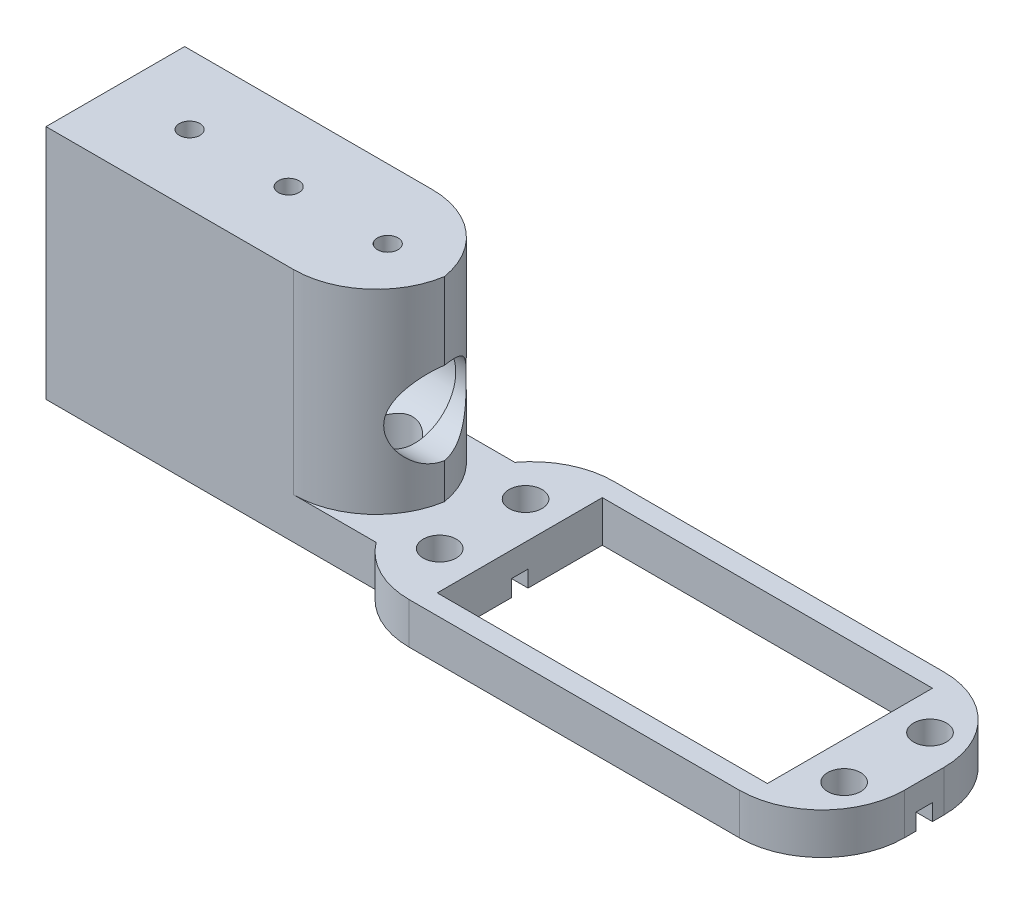
from build123d import *

# Parameters (mm, degrees)
SKETCH1_R           = 2
BOSS_EXTRUDE1_DEPTH = 5
SKETCH2_W           = 2
SKETCH2_H           = 4
CUT_EXTRUDE1_DEPTH  = 63.375956906
BOSS_EXTRUDE2_DEPTH = 28.625
FILLET1_R           = 10
CUT_EXTRUDE2_DEPTH  = 36.25
CUT_EXTRUDE3_REACH  = 73.653
SKETCH5_R           = 5
FILLET4_R           = 10
SKETCH8_R           = 3
CUT_EXTRUDE6_DEPTH  = 22
SKETCH9_R           = 1.25
CUT_EXTRUDE7_DEPTH  = 59.195876265
FILLET5_R           = 2


with BuildPart() as part:
    # Sketch1 → Boss-Extrude1 (new body)
    with BuildSketch(Plane(origin=(0, 0, 0), x_dir=(1, 0, 0), z_dir=(0, 1, 0))):
        Polygon((-9, 2.4), (-9, 0), (-9, -22.4), (49, -22.4), (49, 2.4), align=None)
        with Locations(Location((-4.5, -15.2, 0), (0, 0, 270))):
            Circle(SKETCH1_R, mode=Mode.SUBTRACT)
        with Locations(Location((44.5, -15.2, 0), (0, 0, 270))):
            Circle(SKETCH1_R, mode=Mode.SUBTRACT)
        with Locations(Location((-4.5, -4.8, 0), (0, 0, 270))):
            Circle(SKETCH1_R, mode=Mode.SUBTRACT)
        Polygon((0, -4.8), (0, 0), (20, 0), (40, 0), (40, -10), (40, -20), (20, -20), (0, -20), (0, -10), align=None, mode=Mode.SUBTRACT)
        with Locations(Location((44.5, -4.8, 0), (0, 0, 270))):
            Circle(SKETCH1_R, mode=Mode.SUBTRACT)
    extrude(amount=BOSS_EXTRUDE1_DEPTH)

    # Sketch2 → Cut-Extrude1 (cut, through all)
    with BuildSketch(Plane.ZY.offset(9)):
        with Locations((10, 0)):
            Rectangle(SKETCH2_W, SKETCH2_H)
    extrude(amount=-CUT_EXTRUDE1_DEPTH, mode=Mode.SUBTRACT)

    # Sketch3 → Boss-Extrude2 (add)
    with BuildSketch(Plane.XZ):
        Polygon((-9, 1.6), (-9, 10), (-9, 11), (-9, 18.4), (-49, 18.4), (-49, 1.6), align=None)
    extrude(amount=-BOSS_EXTRUDE2_DEPTH)

    # Fillet1
    # the kernel refuses this fillet: 10 mm, written as the material it takes off along each edge
    with BuildSketch(Plane(origin=(-9, -20, 22.4), x_dir=(0, 0, -1), z_dir=(0, 1, 0))) as fillet1_piece_1:
        with BuildLine():
            CenterArc((10, -8), FILLET1_R, 126.869897646, 53.130102354)
            Line((0, -8), (-0.2, -8))
            Line((-0.2, -8), (-0.2, 0))
            Line((-0.2, 0), (0, 0.2))
            ThreePointArc((0, 0.2), (2, 0.2), (3.88, 0.16))
            Line((3.88, 0.16), (4, 0))
        make_face()
    extrude(amount=45, mode=Mode.SUBTRACT)
    with BuildSketch(Plane(origin=(-9, -20, -2.4), x_dir=(0, 0, 1), z_dir=(0, 1, 0))) as fillet1_piece_2:
        with BuildLine():
            CenterArc((10, 8), FILLET1_R, 180, 53.130102354)
            Line((0, 8), (-0.2, 8))
            Line((-0.2, 8), (-0.2, 0))
            Line((-0.2, 0), (0, -0.2))
            ThreePointArc((0, -0.2), (2, -0.2), (3.88, -0.16))
            Line((3.88, -0.16), (4, 0))
        make_face()
    extrude(amount=45, mode=Mode.SUBTRACT)
    with BuildSketch(Plane(origin=(49, -25, -2.4), x_dir=(-1, 0, 0), z_dir=(0, 1, 0)), Plane(origin=(49, -25, 22.4), x_dir=(0, 0, -1), z_dir=(0, 1, 0))) as fillet1_piece_3:
        with BuildLine():
            CenterArc((FILLET1_R, FILLET1_R), FILLET1_R, 180, 90)
            Line((0, FILLET1_R), (-FILLET1_R * 0.02, FILLET1_R))
            Line((-FILLET1_R * 0.02, FILLET1_R), (-FILLET1_R * 0.02, -FILLET1_R * 0.02))
            Line((-FILLET1_R * 0.02, -FILLET1_R * 0.02), (FILLET1_R, -FILLET1_R * 0.02))
            Line((FILLET1_R, -FILLET1_R * 0.02), (FILLET1_R, 0))
        make_face()
    extrude(amount=55, mode=Mode.SUBTRACT)

    # Sketch4 → Cut-Extrude2 (cut)
    with BuildSketch(Plane.ZY.offset(49)):
        with BuildLine():
            ThreePointArc((16.1, 14.3125), (13.031141398, 19.606098193), (6.912399402, 19.573367091))
            Line((6.912399402, 19.573367091), (13.087600598, 9.051632909))
            ThreePointArc((13.087600598, 9.051632909), (15.293598193, 11.281358602), (16.1, 14.3125))
        make_face()
        with BuildLine():
            Line((13.087600598, 9.051632909), (6.912399402, 19.573367091))
            ThreePointArc((6.912399402, 19.573367091), (4.739132909, 11.224899402), (13.087600598, 9.051632909))
        make_face()
    extrude(amount=-CUT_EXTRUDE2_DEPTH, mode=Mode.SUBTRACT)

    # Sketch5 → Cut-Extrude3 (cut, up to next)
    with BuildSketch(Plane.ZY.offset(12.75), mode=Mode.PRIVATE) as cut_extrude3_sk1:
        with Locations((10, 14.3125)):
            Circle(SKETCH5_R)
    cut_extrude3_tool1 = extrude(cut_extrude3_sk1.sketch, amount=-CUT_EXTRUDE3_REACH, mode=Mode.PRIVATE) & part.part
    add(cut_extrude3_tool1.solids().sort_by_distance((-12.75, 14.3125, 10))[0], mode=Mode.SUBTRACT)

    # Fillet4
    # the kernel refuses this fillet: 10 mm, written as the material it takes off along each edge
    with BuildSketch(Plane(origin=(-9, 53.625, 1.6), x_dir=(-1, 0, 0), z_dir=(0, -1, 0))) as fillet4_piece_1:
        with BuildLine():
            CenterArc((FILLET4_R, -FILLET4_R), FILLET4_R, 90, 90)
            Line((0, -FILLET4_R), (0, 0))
            Line((0, 0), (FILLET4_R, 0))
        make_face()
    extrude(amount=48.625, mode=Mode.SUBTRACT)
    with BuildSketch(Plane(origin=(-9, 5, 18.4), x_dir=(0, 0, -1), z_dir=(0, 1, 0))) as fillet4_piece_2:
        with BuildLine():
            CenterArc((FILLET4_R, FILLET4_R), FILLET4_R, 180, 90)
            Line((0, FILLET4_R), (0, 0))
            Line((0, 0), (FILLET4_R, 0))
        make_face()
    extrude(amount=48.625, mode=Mode.SUBTRACT)

    # Sketch8 → Cut-Extrude6 (cut)
    with BuildSketch(Plane.XZ):
        with Locations(Location((-40, 10, 0), (0, 0, 270))):
            Circle(SKETCH8_R)
        with Locations(Location((-28, 10, 0), (0, 0, 270))):
            Circle(SKETCH8_R)
        with Locations(Location((-16, 10, 0), (0, 0, 270))):
            Circle(SKETCH8_R)
    extrude(amount=-CUT_EXTRUDE6_DEPTH, mode=Mode.SUBTRACT)

    # Sketch9 → Cut-Extrude7 (cut, through all)
    with BuildSketch(Plane.XZ.offset(-22)):
        with Locations(Location((-40, 10, 0), (0, 0, 270))):
            Circle(SKETCH9_R)
        with Locations(Location((-28, 10, 0), (0, 0, 270))):
            Circle(SKETCH9_R)
        with Locations(Location((-16, 10, 0), (0, 0, 270))):
            Circle(SKETCH9_R)
    extrude(amount=-CUT_EXTRUDE7_DEPTH, mode=Mode.SUBTRACT)

    # Fillet5
    fillet5_edges = [part.edges().sort_by_distance(p)[0] for p in [
        (-49, 9.051632909, 13.087600598),
    ]]
    fillet(fillet5_edges, radius=FILLET5_R)


solid = part.part
